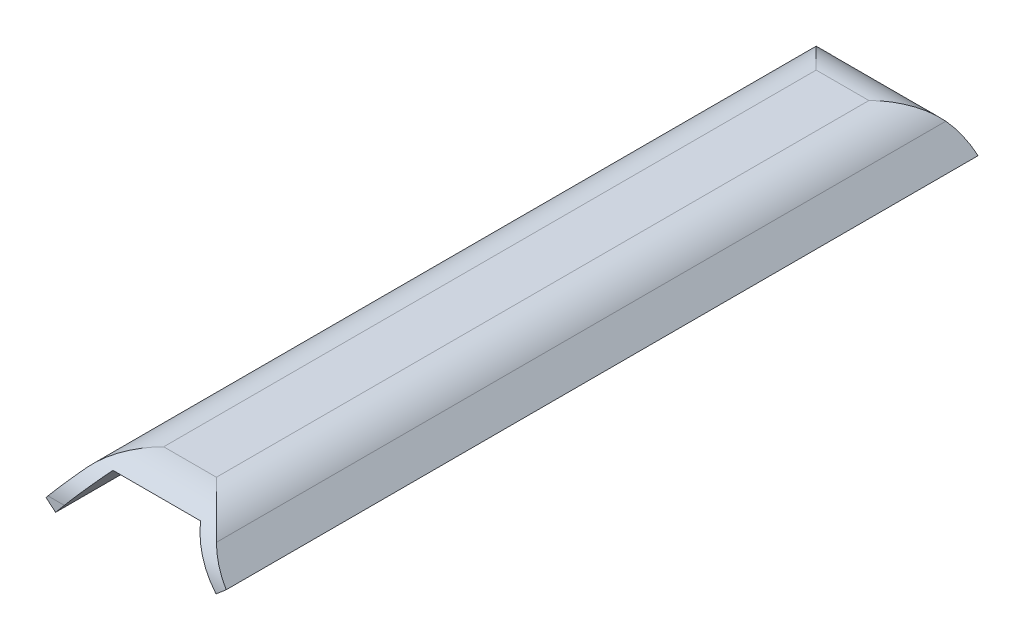
from build123d import *

# Parameters (mm, degrees)
EXTRUDE_THIN1_DEPTH = 600
FILLET2_R           = 40


with BuildPart() as part:
    # Sketch1 → Extrude-Thin1 (new body)
    with BuildSketch(Plane.XY):
        Polygon((-32.139380484, -38.302222156), (0, 0), (70, 0), (95.711504387, -30.641777725), (103.371948819, -24.213901628), (74.663076582, 10), (-4.663076582, 10), (-39.799824916, -31.874346059), align=None)
    extrude(amount=EXTRUDE_THIN1_DEPTH)

    # Fillet2
    # the kernel refuses this fillet: 40 mm, written as the material it takes off along each edge
    with BuildSketch(Plane(origin=(74.663076582, 10, -46.630765815), x_dir=(0.6427876096865376, -0.7660444431189795, 0), z_dir=(0, 0, 1)), Plane(origin=(-4.663076582, 10, -46.630765815), x_dir=(1, 0, 0), z_dir=(0, 0, 1))) as fillet2_piece_1:
        with BuildLine():
            CenterArc((FILLET2_R * 0.466307658155, -FILLET2_R), FILLET2_R, 90, 50)
            Line((-FILLET2_R * 0.299736784964, -FILLET2_R * 0.357212390313), (0, 0))
            Line((0, 0), (FILLET2_R * 0.466307658155, 0))
        make_face()
    extrude(amount=693.261531631, mode=Mode.SUBTRACT)
    with BuildSketch(Plane(origin=(174.663076582, 10, 600), x_dir=(0, 0, -1), z_dir=(-1, 0, 0))) as fillet2_piece_2:
        with BuildLine():
            CenterArc((FILLET2_R, FILLET2_R), FILLET2_R, 180, 90)
            Line((0, FILLET2_R), (0, 0))
            Line((0, 0), (FILLET2_R, 0))
        make_face()
    extrude(amount=279.326153163, mode=Mode.SUBTRACT)
    with BuildSketch(Plane(origin=(174.663076582, 10, 0), x_dir=(0, 0, 1), z_dir=(-1, 0, 0))) as fillet2_piece_3:
        with BuildLine():
            CenterArc((FILLET2_R, -FILLET2_R), FILLET2_R, 90, 90)
            Line((0, -FILLET2_R), (0, 0))
            Line((0, 0), (FILLET2_R, 0))
        make_face()
    extrude(amount=279.326153163, mode=Mode.SUBTRACT)


solid = part.part
